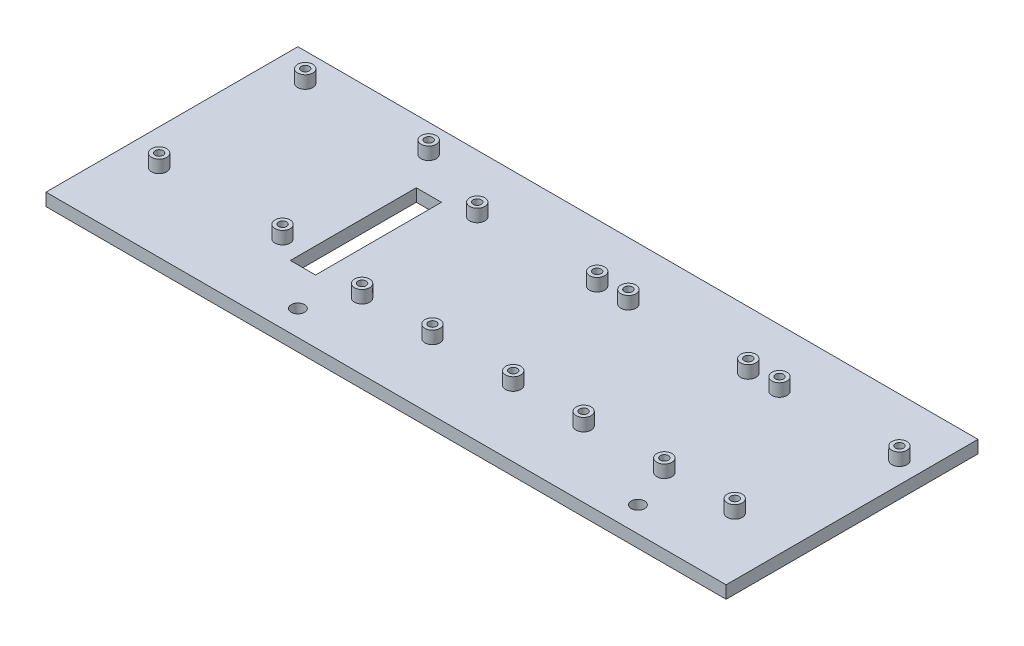
from build123d import *

# Parameters (mm, degrees)
SKETCH1_W           = 270
SKETCH1_H           = 100
BOSS_EXTRUDE1_DEPTH = 5
SKETCH3_R           = 3
SKETCH3_R_2         = 1.6
BOSS_EXTRUDE2_DEPTH = 5
CUT_EXTRUDE1_START  = -5
SKETCH4_R           = 1.6
CUT_EXTRUDE1_DEPTH  = 5
SKETCH5_R           = 3.25
CUT_EXTRUDE2_DEPTH  = 3.2
SKETCH6_R           = 1.6
CUT_EXTRUDE3_DEPTH  = 23.2
BOSS_EXTRUDE3_START = 5
SKETCH7_R           = 3
SKETCH7_R_2         = 1.6
BOSS_EXTRUDE3_DEPTH = 5
SKETCH8_R           = 3.25
CUT_EXTRUDE4_DEPTH  = 3.2
LPATTERN1_COUNT     = 3
LPATTERN1_PITCH     = 60
SKETCH9_W           = 10
SKETCH9_H           = 50
CUT_EXTRUDE5_DEPTH  = 13.2
SKETCH10_R          = 2.65
CUT_EXTRUDE6_DEPTH  = 23.2


with BuildPart() as part:
    # Sketch1 → Boss-Extrude1 (new body)
    with BuildSketch(Plane(origin=(0, 0, 0), x_dir=(1, 0, 0), z_dir=(0, 1, 0))):
        with Locations((135, 50)):
            Rectangle(SKETCH1_W, SKETCH1_H)
    extrude(amount=BOSS_EXTRUDE1_DEPTH)

    # Sketch3 → Boss-Extrude2 (add)
    # profile 1 of 4: a face of its own
    with BuildSketch(Plane(origin=(0, 5, 0), x_dir=(1, 0, 0), z_dir=(0, 1, 0))):
        with Locations((14.003763212, 88.913523518)):
            Circle(SKETCH3_R)
        with Locations((14.003763212, 88.913523518)):
            Circle(SKETCH3_R_2, mode=Mode.SUBTRACT)
    # profile 2 of 4: a face of its own
    with BuildSketch(Plane(origin=(0, 5, 0), x_dir=(1, 0, 0), z_dir=(0, 1, 0))):
        with Locations((63.003763212, 88.913523518)):
            Circle(SKETCH3_R)
        with Locations((63.003763212, 88.913523518)):
            Circle(SKETCH3_R_2, mode=Mode.SUBTRACT)
    # profile 3 of 4: a face of its own
    with BuildSketch(Plane(origin=(0, 5, 0), x_dir=(1, 0, 0), z_dir=(0, 1, 0))):
        with Locations((14.003763212, 30.913523518)):
            Circle(SKETCH3_R)
        with Locations((14.003763212, 30.913523518)):
            Circle(SKETCH3_R_2, mode=Mode.SUBTRACT)
    # profile 4 of 4: a face of its own
    with BuildSketch(Plane(origin=(0, 5, 0), x_dir=(1, 0, 0), z_dir=(0, 1, 0))):
        with Locations((63.003763212, 30.913523518)):
            Circle(SKETCH3_R)
        with Locations((63.003763212, 30.913523518)):
            Circle(SKETCH3_R_2, mode=Mode.SUBTRACT)
    extrude(amount=BOSS_EXTRUDE2_DEPTH)

    # Sketch4 → Cut-Extrude1 (cut)
    with BuildSketch(Plane(origin=(0, 5, 0), x_dir=(1, 0, 0), z_dir=(0, 1, 0)).offset(CUT_EXTRUDE1_START)):
        with Locations((14.003763212, 88.913523518)):
            Circle(SKETCH4_R)
        with Locations((63.003763212, 88.913523518)):
            Circle(SKETCH4_R)
        with Locations((63.003763212, 30.913523518)):
            Circle(SKETCH4_R)
        with Locations((14.003763212, 30.913523518)):
            Circle(SKETCH4_R)
    extrude(amount=CUT_EXTRUDE1_DEPTH, mode=Mode.SUBTRACT)

    # Sketch5 → Cut-Extrude2 (cut)
    with BuildSketch(Plane(origin=(0, 0, 0), x_dir=(-1, 0, 0), z_dir=(0, -1, 0))):
        with Locations((-63.003763212, 88.913523518)):
            Circle(SKETCH5_R)
        with Locations((-14.003763212, 88.913523518)):
            Circle(SKETCH5_R)
        with Locations((-14.003763212, 30.913523518)):
            Circle(SKETCH5_R)
        with Locations((-63.003763212, 30.913523518)):
            Circle(SKETCH5_R)
    extrude(amount=-CUT_EXTRUDE2_DEPTH, mode=Mode.SUBTRACT)

    # Sketch6 → Cut-Extrude3 (cut)
    with BuildSketch(Plane(origin=(0, 5, 0), x_dir=(1, 0, 0), z_dir=(0, 1, 0))):
        with Locations((141.631313549, 77.173523518)):
            Circle(SKETCH6_R)
        with Locations((94.031313549, 77.173523518)):
            Circle(SKETCH6_R)
        with Locations((99.111313549, 26.373523518)):
            Circle(SKETCH6_R)
        with Locations((127.051313549, 26.373523518)):
            Circle(SKETCH6_R)
        with Locations((154.031313549, 77.173523518)):
            Circle(SKETCH6_R)
        with Locations((159.111313549, 26.373523518)):
            Circle(SKETCH6_R)
        with Locations((187.051313549, 26.373523518)):
            Circle(SKETCH6_R)
        with Locations((201.631313549, 77.173523518)):
            Circle(SKETCH6_R)
        with Locations((214.031313549, 77.173523518)):
            Circle(SKETCH6_R)
        with Locations((219.111313549, 26.373523518)):
            Circle(SKETCH6_R)
        with Locations((247.051313549, 26.373523518)):
            Circle(SKETCH6_R)
        with Locations((261.631313549, 77.173523518)):
            Circle(SKETCH6_R)
    extrude(amount=-CUT_EXTRUDE3_DEPTH, mode=Mode.SUBTRACT)

    # Sketch7 → Boss-Extrude3 (add)
    # profile 1 of 4: a face of its own
    with BuildSketch(Plane(origin=(0, 5, 0), x_dir=(1, 0, 0), z_dir=(0, 1, 0)).offset(BOSS_EXTRUDE3_START)):
        with Locations((94.031313549, 77.173523518)):
            Circle(SKETCH7_R)
        with Locations((94.031313549, 77.173523518)):
            Circle(SKETCH7_R_2, mode=Mode.SUBTRACT)
    # profile 2 of 4: a face of its own
    with BuildSketch(Plane(origin=(0, 5, 0), x_dir=(1, 0, 0), z_dir=(0, 1, 0)).offset(BOSS_EXTRUDE3_START)):
        with Locations((141.631313549, 77.173523518)):
            Circle(SKETCH7_R)
        with Locations((141.631313549, 77.173523518)):
            Circle(SKETCH7_R_2, mode=Mode.SUBTRACT)
    # profile 3 of 4: a face of its own
    with BuildSketch(Plane(origin=(0, 5, 0), x_dir=(1, 0, 0), z_dir=(0, 1, 0)).offset(BOSS_EXTRUDE3_START)):
        with Locations((127.051313549, 26.373523518)):
            Circle(SKETCH7_R)
        with Locations((127.051313549, 26.373523518)):
            Circle(SKETCH7_R_2, mode=Mode.SUBTRACT)
    # profile 4 of 4: a face of its own
    with BuildSketch(Plane(origin=(0, 5, 0), x_dir=(1, 0, 0), z_dir=(0, 1, 0)).offset(BOSS_EXTRUDE3_START)):
        with Locations((99.111313549, 26.373523518)):
            Circle(SKETCH7_R)
        with Locations((99.111313549, 26.373523518)):
            Circle(SKETCH7_R_2, mode=Mode.SUBTRACT)
    boss_extrude3 = extrude(amount=-BOSS_EXTRUDE3_DEPTH)

    # Sketch8 → Cut-Extrude4 (cut)
    with BuildSketch(Plane.XZ):
        with Locations((94.031313549, -77.173523518)):
            Circle(SKETCH8_R)
        with Locations((99.111313549, -26.373523518)):
            Circle(SKETCH8_R)
        with Locations((127.051313549, -26.373523518)):
            Circle(SKETCH8_R)
        with Locations((141.631313549, -77.173523518)):
            Circle(SKETCH8_R)
    cut_extrude4 = extrude(amount=-CUT_EXTRUDE4_DEPTH, mode=Mode.SUBTRACT)

    # LPattern1: Boss-Extrude3, Cut-Extrude4 ×3
    with Locations(*[(i * LPATTERN1_PITCH, 0, 0) for i in range(1, LPATTERN1_COUNT)]):
        add(boss_extrude3)
        add(cut_extrude4, mode=Mode.SUBTRACT)

    # Sketch9 → Cut-Extrude5 (cut)
    with BuildSketch(Plane(origin=(0, 5, 0), x_dir=(1, 0, 0), z_dir=(0, 1, 0))):
        with Locations((77, 50)):
            Rectangle(SKETCH9_W, SKETCH9_H)
    extrude(amount=-CUT_EXTRUDE5_DEPTH, mode=Mode.SUBTRACT)

    # Sketch10 → Cut-Extrude6 (cut)
    with BuildSketch(Plane(origin=(0, 5, 0), x_dir=(1, 0, 0), z_dir=(0, 1, 0))):
        with Locations((225, 10)):
            Circle(SKETCH10_R)
        with Locations((90, 10)):
            Circle(SKETCH10_R)
    extrude(amount=-CUT_EXTRUDE6_DEPTH, mode=Mode.SUBTRACT)


solid = part.part
